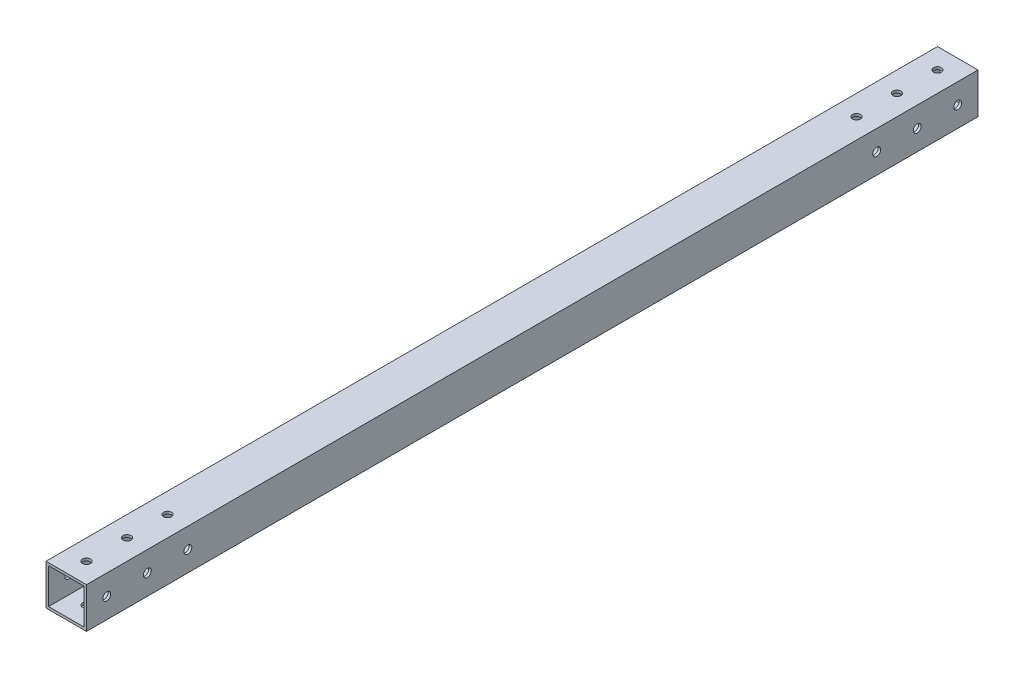
from build123d import *

# Parameters (mm, degrees)
SKETCH1_W           = 25.4
SKETCH1_H           = 25.4
BOSS_EXTRUDE1_DEPTH = 279.4
SHELL1_T            = -1.5875
SKETCH2_R           = 2.4892
CUT_EXTRUDE1_DEPTH  = 282.699627263
SKETCH3_R           = 2.4892
CUT_EXTRUDE2_DEPTH  = 282.699627263


with BuildPart() as part:
    # Sketch1 → Boss-Extrude1 (new, symmetric)
    with BuildSketch(Plane.XY):
        with Locations((12.7, 12.7)):
            Rectangle(SKETCH1_W, SKETCH1_H)
    extrude(amount=BOSS_EXTRUDE1_DEPTH, both=True)

    # Shell1
    shell1_openings = [part.faces().sort_by_distance(p)[0] for p in [
        (12.7, 12.7, 279.4),
        (12.7, 12.7, -279.4),
    ]]
    offset(amount=SHELL1_T, openings=shell1_openings, kind=Kind.INTERSECTION)

    # Sketch2 → Cut-Extrude1 (cut, through all)
    with BuildSketch(Plane(origin=(0, 25.4, 0), x_dir=(1, 0, 0), z_dir=(0, 1, 0))):
        with Locations((12.7, -266.7)):
            Circle(SKETCH2_R)
        with Locations((12.7, -241.3)):
            Circle(SKETCH2_R)
        with Locations((12.7, -215.9)):
            Circle(SKETCH2_R)
    cut_extrude1 = extrude(amount=-CUT_EXTRUDE1_DEPTH, mode=Mode.SUBTRACT)

    # Sketch3 → Cut-Extrude2 (cut, through all)
    with BuildSketch(Plane.ZY):
        with Locations((266.7, 12.7)):
            Circle(SKETCH3_R)
        with Locations((241.3, 12.7)):
            Circle(SKETCH3_R)
        with Locations((215.9, 12.7)):
            Circle(SKETCH3_R)
    cut_extrude2 = extrude(amount=-CUT_EXTRUDE2_DEPTH, mode=Mode.SUBTRACT)

    # Mirror1: Cut-Extrude1, Cut-Extrude2 across plane
    add(cut_extrude1.mirror(Plane.XY), mode=Mode.SUBTRACT)
    add(cut_extrude2.mirror(Plane.XY), mode=Mode.SUBTRACT)


solid = part.part
